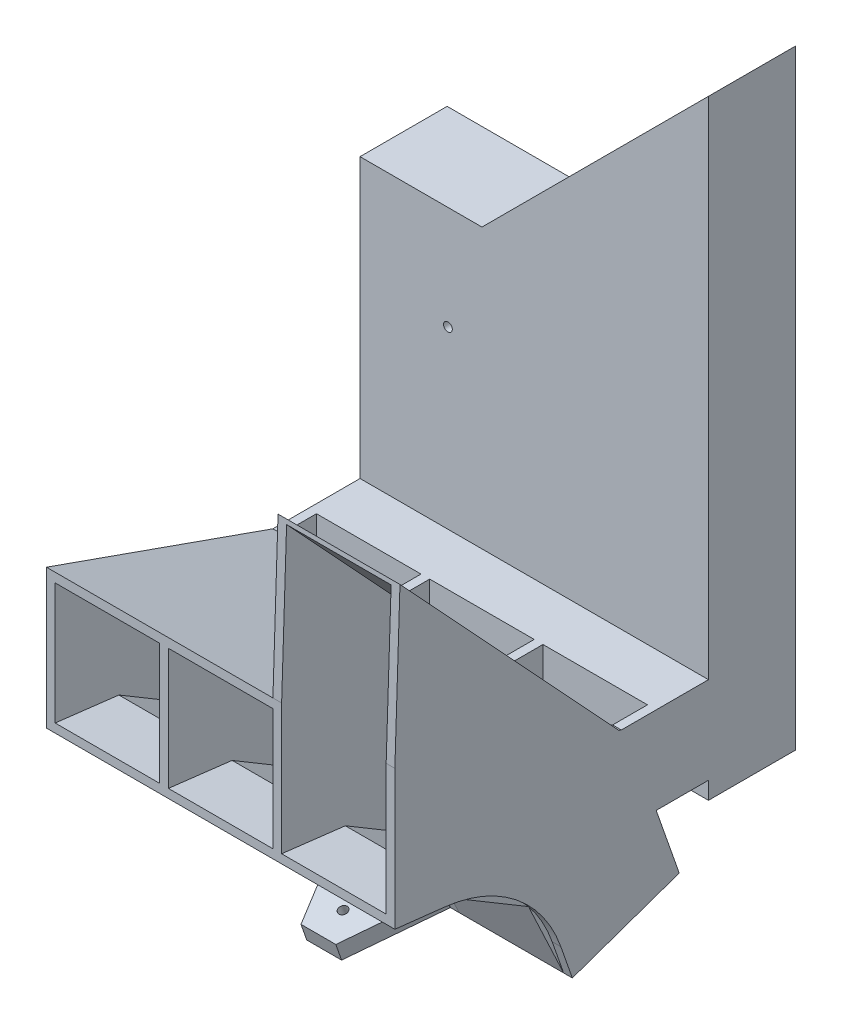
from build123d import *

# Parameters (mm, degrees)
P_IDAT_VYSUNUT_M1_DEPTH  = 50
SKICA7_W                 = 200
SKICA7_H                 = 50
P_IDAT_VYSUNUT_M5_DEPTH  = 30
P_IDAT_VYSUNUT_M6_DEPTH  = 5
LINPOLE1_COUNT           = 4
LINPOLE1_PITCH           = 65
P_IDAT_VYSUNUT_M10_DEPTH = 60
LINPOLE3_COUNT           = 3
LINPOLE3_PITCH           = 65
SKICA17_W                = 60
SKICA17_H                = 132.33
ODEBRAT_VYSUNUT_M3_DEPTH = 10
P_IDAT_VYSUNUT_M12_DEPTH = 5
LINPOLE4_COUNT           = 2
LINPOLE4_PITCH           = 65
P_IDAT_VYSUNUT_M13_DEPTH = 60
SKICA20_R                = 2.5
ODEBRAT_VYSUNUT_M4_DEPTH = 10
P_IDAT_VYSUNUT_M15_DEPTH = 10
SKICA22_R                = 2.5
ODEBRAT_VYSUNUT_M5_DEPTH = 10


with BuildPart() as part:
    # Skica1 → Přidat vysunutím1 (new body)
    with BuildSketch(Plane.XY):
        Polygon((0, 0), (200, 0), (200, 350), (70, 220), (0, 220), align=None)
    extrude(amount=P_IDAT_VYSUNUT_M1_DEPTH)

    # Skica7 → Přidat vysunutím5 (add)
    with BuildSketch(Plane.XY.offset(50)):
        with Locations((100, 35)):
            Rectangle(SKICA7_W, SKICA7_H)
    extrude(amount=P_IDAT_VYSUNUT_M5_DEPTH)

    # Skica9 → Přidat vysunutím6 (add)
    with BuildSketch(Plane.ZY):
        with BuildLine():
            Line((80, 10), (66.774778957, -27.75041097))
            Line((66.774778957, -27.75041097), (128.119196783, -49.241395164))
            Line((128.119196783, -49.241395164), (134.731807304, -30.366189679))
            ThreePointArc((134.731807304, -30.366189679), (160.364777666, 5.738922578), (201.274673199, 22.680255114))
            Line((201.274673199, 22.680255114), (230, 25.917114128))
            Line((230, 25.917114128), (230, 105.917114128))
            Line((230, 105.917114128), (100, 60))
            Line((100, 60), (80, 60))
            Line((80, 60), (80, 10))
        make_face()
    p_idat_vysunut_m6 = extrude(amount=-P_IDAT_VYSUNUT_M6_DEPTH)

    # LinPole1: Přidat vysunutím6 ×4
    with Locations(*[(i * LINPOLE1_PITCH, 0, 0) for i in range(1, LINPOLE1_COUNT)]):
        add(p_idat_vysunut_m6)

    # Skica12 → Přidat vysunutím10 (add)
    with BuildSketch(Plane(origin=(5, 0, 0), x_dir=(0, 0, -1), z_dir=(1, 0, 0))):
        Polygon((-230, 105.917114128), (-230, 100.61438772), (-105.220267206, 56.541116708), (-71.496803297, -29.404692713), (-66.774778957, -27.75041097), (-101.40042077, 60.494640618), align=None)
        Polygon((-230, 25.917114128), (-230, 30.952852669), (-193.421577993, 26.571602615), (-144.481791005, -2.596155027), (-123.37587339, -47.579651656), (-128.119196783, -49.241395164), (-148.357587613, -6.10687705), (-195.069843452, 21.733288203), align=None)
    p_idat_vysunut_m10 = extrude(amount=P_IDAT_VYSUNUT_M10_DEPTH)

    # LinPole3: Přidat vysunutím10 ×3
    with Locations(*[(i * LINPOLE3_PITCH, 0, 0) for i in range(1, LINPOLE3_COUNT)]):
        add(p_idat_vysunut_m10)

    # Skica17 → Odebrat vysunutím3 (cut)
    with BuildSketch(Plane(origin=(0, 21.941769172, -7.750020917), x_dir=(1, 0, 0), z_dir=(0, 0.9429111773554218, -0.33304430879120595))):
        with Locations((165, -185.979662856)):
            Rectangle(SKICA17_W, SKICA17_H)
    extrude(amount=-ODEBRAT_VYSUNUT_M3_DEPTH, mode=Mode.SUBTRACT)

    # Skica18 → Přidat vysunutím12 (add)
    with BuildSketch(Plane(origin=(135, 0, 0), x_dir=(0, 0, -1), z_dir=(1, 0, 0))):
        Polygon((-101.40042077, 60.494640618), (-227.071424446, 195.869453982), (-230, 105.917114128), align=None)
    p_idat_vysunut_m12 = extrude(amount=-P_IDAT_VYSUNUT_M12_DEPTH)

    # LinPole4: Přidat vysunutím12 ×2
    with Locations(*[(i * LINPOLE4_PITCH, 0, 0) for i in range(1, LINPOLE4_COUNT)]):
        add(p_idat_vysunut_m12)

    # Skica19 → Přidat vysunutím13 (add)
    with BuildSketch(Plane(origin=(135, 0, 0), x_dir=(0, 0, -1), z_dir=(1, 0, 0))):
        Polygon((-227.071424446, 195.869453982), (-101.40042077, 60.494640618), (-105.224563901, 61.845360745), (-227.158510983, 193.194557029), align=None)
    extrude(amount=P_IDAT_VYSUNUT_M13_DEPTH)

    # Skica20 → Odebrat vysunutím4 (cut)
    with BuildSketch(Plane.XY.offset(50)):
        with Locations((50.459484354, 160.603206666)):
            Circle(SKICA20_R)
    extrude(amount=-ODEBRAT_VYSUNUT_M4_DEPTH, mode=Mode.SUBTRACT)

    # Skica21 → Přidat vysunutím15 (add)
    with BuildSketch(Plane(origin=(0, -3.880699941, -1.359537902), x_dir=(1, 0, 0), z_dir=(0, -0.9437602742382316, -0.3306305260706848))):
        Polygon((70, 137.194516678), (90, 182.194516678), (110, 182.194516678), (130, 137.194516678), align=None)
    extrude(amount=-P_IDAT_VYSUNUT_M15_DEPTH)

    # Skica22 → Odebrat vysunutím5 (cut)
    with BuildSketch(Plane(origin=(0, -3.880699941, -1.359537902), x_dir=(1, 0, 0), z_dir=(0, -0.9437602742382316, -0.3306305260706848))):
        with Locations((100, 167.194516678)):
            Circle(SKICA22_R)
    extrude(amount=-ODEBRAT_VYSUNUT_M5_DEPTH, mode=Mode.SUBTRACT)


solid = part.part
